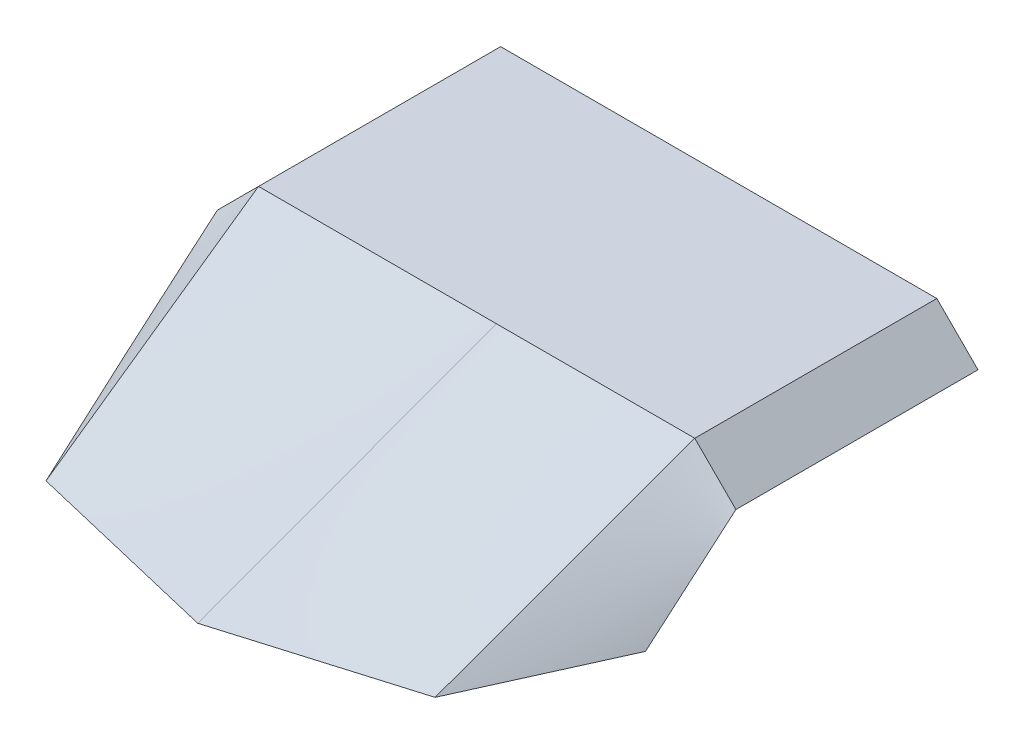
from build123d import *

# Parameters (mm, degrees)
BOSS_EXTRUDE1_DEPTH = 71.26


with BuildPart() as part:
    # Loft13: read off the stored shape, not the designer's step
    # Loft13: loft between two sections, ruled curve by curve
    loft13_from = [
        Edge.make_bspline([(-79.603627765, 0, 56.755489551), (-76.115966153, 0, 64.213426555), (-72.628304542, 0, 71.67136356), (-65.652981318, 0, 86.587237568), (-62.165319707, 0, 94.045174572), (-58.677658095, 0, 101.503111577)], [0, 0, 0, 0, 0.5, 0.5, 1, 1, 1, 1], 3),
        Edge.make_bspline([(-58.677658095, 0, 101.503111577), (-48.906538694, 0, 103.830924441), (-39.135419292, 0, 106.158737306), (-19.59318049, 0, 110.814363034), (-9.822061088, 0, 113.142175899), (-0.050941687, 0, 115.469988763)], [0, 0, 0, 0, 0.5, 0.5, 1, 1, 1, 1], 3),
        Edge.make_bspline([(-74.603627765, 0, 56.755489551), (-75.436961098, 0, 56.755489551), (-76.270294432, 0, 56.755489551), (-77.936961098, 0, 56.755489551), (-78.770294432, 0, 56.755489551), (-79.603627765, 0, 56.755489551)], [0, 0, 0, 0, 0.5, 0.5, 1, 1, 1, 1], 3),
        Edge.make_bspline([(-0.050941687, 0, 115.469988763), (8.91697935, 0, 112.796539052), (17.884900386, 0, 110.12308934), (35.820742459, 0, 104.776189918), (44.788663496, 0, 102.102740206), (53.756584532, 0, 99.429290495)], [0, 0, 0, 0, 0.5, 0.5, 1, 1, 1, 1], 3),
        Edge.make_bspline([(53.756584532, 0, 99.429290495), (56.963215816, 0, 92.316990338), (60.1698471, 0, 85.20469018), (66.583109668, 0, 70.980089866), (69.789740951, 0, 63.867789708), (72.996372235, 0, 56.755489551)], [0, 0, 0, 0, 0.5, 0.5, 1, 1, 1, 1], 3),
        Edge.make_bspline([(72.996372235, 0, 56.755489551), (72.163038902, 0, 56.755489551), (71.329705568, 0, 56.755489551), (69.663038902, 0, 56.755489551), (68.829705568, 0, 56.755489551), (67.996372235, 0, 56.755489551)], [0, 0, 0, 0, 0.5, 0.5, 1, 1, 1, 1], 3),
        Edge.make_bspline([(67.996372235, 0, 56.755489551), (65.019950017, 0, 63.178013733), (62.043527798, 0, 69.600537914), (56.090683362, 0, 82.445586278), (53.114261143, 0, 88.86811046), (50.137838925, 0, 95.290634641)], [0, 0, 0, 0, 0.5, 0.5, 1, 1, 1, 1], 3),
        Edge.make_bspline([(50.137838925, 0, 95.290634641), (41.74895364, 0, 97.791466534), (33.360068355, 0, 100.292298427), (16.582297786, 0, 105.293962214), (8.193412501, 0, 107.794794107), (-0.195472784, 0, 110.295626)], [0, 0, 0, 0, 0.5, 0.5, 1, 1, 1, 1], 3),
        Edge.make_bspline([(-0.195472784, 0, 110.295626), (-9.358047044, 0, 108.112789279), (-18.520621304, 0, 105.929952558), (-36.845769825, 0, 101.564279116), (-46.008344086, 0, 99.381442395), (-55.170918346, 0, 97.198605674)], [0, 0, 0, 0, 0.5, 0.5, 1, 1, 1, 1], 3),
        Edge.make_bspline([(-55.170918346, 0, 97.198605674), (-58.409703249, 0, 90.45808632), (-61.648488152, 0, 83.717566966), (-68.126057959, 0, 70.236528259), (-71.364842862, 0, 63.496008905), (-74.603627765, 0, 56.755489551)], [0, 0, 0, 0, 0.5, 0.5, 1, 1, 1, 1], 3),
    ]
    loft13_to = [
        Edge.make_bspline([(-79.755478337, 22.698681281, 30), (-77.736400655, 24.717758964, 30), (-75.717322973, 26.736836646, 30), (-71.679167608, 30.774992011, 30), (-69.660089926, 32.794069693, 30), (-67.641012243, 34.813147375, 30)], [0, 0, 0, 0, 0.5, 0.5, 1, 1, 1, 1], 3),
        Edge.make_bspline([(-67.641012243, 34.813147375, 30), (-55.973275602, 34.813147375, 30), (-44.305538961, 34.813147375, 30), (-20.97006568, 34.813147375, 30), (-9.302329039, 34.813147375, 30), (2.365407602, 34.813147375, 30)], [0, 0, 0, 0, 0.5, 0.5, 1, 1, 1, 1], 3),
        Edge.make_bspline([(-74.755478337, 20.62761347, 30), (-75.588811671, 20.972791438, 30), (-76.422145004, 21.317969407, 30), (-78.088811671, 22.008325344, 30), (-78.922145004, 22.353503313, 30), (-79.755478337, 22.698681281, 30)], [0, 0, 0, 0, 0.5, 0.5, 1, 1, 1, 1], 3),
        Edge.make_bspline([(2.365407602, 34.813147375, 30), (12.09284893, 34.813147375, 30), (21.820290258, 34.813147375, 30), (41.275172913, 34.813147375, 30), (51.002614241, 34.813147375, 30), (60.730055569, 34.813147375, 30)], [0, 0, 0, 0, 0.5, 0.5, 1, 1, 1, 1], 3),
        Edge.make_bspline([(60.730055569, 34.813147375, 30), (62.749133251, 32.794069693, 30), (64.768210933, 30.774992011, 30), (68.806366298, 26.736836646, 30), (70.82544398, 24.717758964, 30), (72.844521663, 22.698681281, 30)], [0, 0, 0, 0, 0.5, 0.5, 1, 1, 1, 1], 3),
        Edge.make_bspline([(72.844521663, 22.698681281, 30), (72.011188329, 22.353503313, 30), (71.177854996, 22.008325344, 30), (69.511188329, 21.317969407, 30), (68.677854996, 20.972791438, 30), (67.844521663, 20.62761347, 30)], [0, 0, 0, 0, 0.5, 0.5, 1, 1, 1, 1], 3),
        Edge.make_bspline([(67.844521663, 20.62761347, 30), (66.313599345, 22.158535787, 30), (64.782677027, 23.689458105, 30), (61.720832392, 26.75130274, 30), (60.189910074, 28.282225058, 30), (58.658987757, 29.813147375, 30)], [0, 0, 0, 0, 0.5, 0.5, 1, 1, 1, 1], 3),
        Edge.make_bspline([(58.658987757, 29.813147375, 30), (47.117545897, 29.813147375, 30), (35.576104037, 29.813147375, 30), (12.493220317, 29.813147375, 30), (0.951778457, 29.813147375, 30), (-10.589663403, 29.813147375, 30)], [0, 0, 0, 0, 0.5, 0.5, 1, 1, 1, 1], 3),
        Edge.make_bspline([(-10.589663403, 29.813147375, 30), (-19.753043574, 29.813147375, 30), (-28.916423746, 29.813147375, 30), (-47.243184088, 29.813147375, 30), (-56.40656426, 29.813147375, 30), (-65.569944431, 29.813147375, 30)], [0, 0, 0, 0, 0.5, 0.5, 1, 1, 1, 1], 3),
        Edge.make_bspline([(-65.569944431, 29.813147375, 30), (-67.100866749, 28.282225058, 30), (-68.631789067, 26.75130274, 30), (-71.693633702, 23.689458105, 30), (-73.22455602, 22.158535787, 30), (-74.755478337, 20.62761347, 30)], [0, 0, 0, 0, 0.5, 0.5, 1, 1, 1, 1], 3),
    ]
    loft13 = Solid(Shell([*[Face.make_surface_from_curves(loft13_from[k], loft13_to[k]) for k in range(10)], Face(Wire(loft13_from)), Face(Wire(loft13_to))]))
    add(loft13)

    # Sketch9 → Boss-Extrude1 (add)
    with BuildSketch(Plane.XY.offset(30)):
        Polygon((-79.770999887, 22.67425966), (-74.770999887, 20.603191848), (-65.585465981, 29.788725754), (58.643466207, 29.788725754), (67.829000113, 20.603191848), (72.829000113, 22.67425966), (60.714534019, 34.788725754), (-67.656533793, 34.788725754), align=None)
    extrude(amount=-BOSS_EXTRUDE1_DEPTH)


solid = part.part
